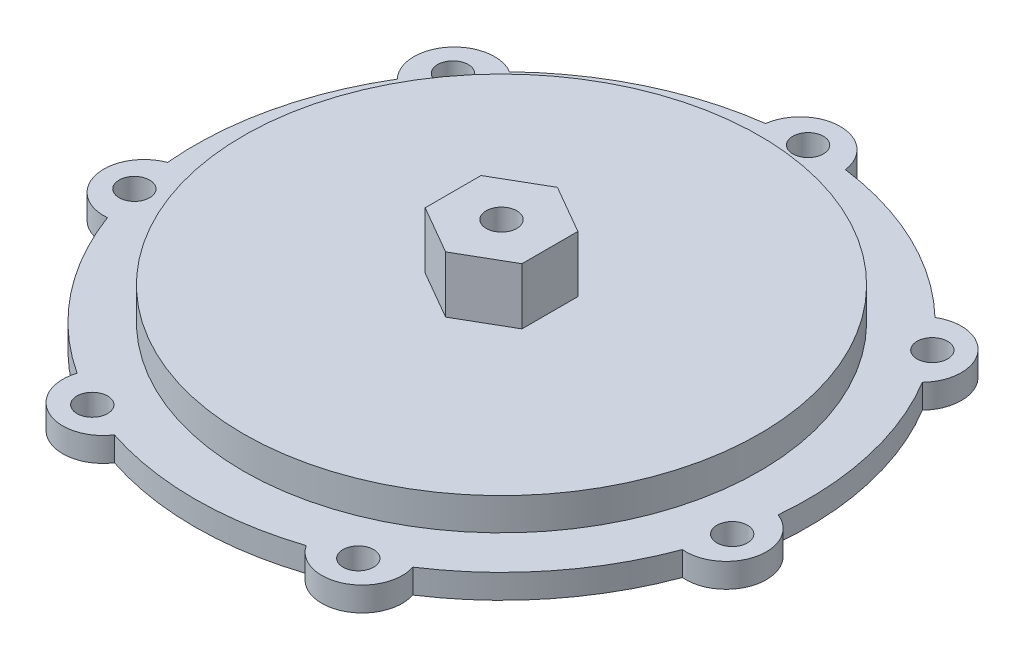
from build123d import *

# Parameters (mm, degrees)
SKETCH1_R           = 38
BOSS_EXTRUDE6_DEPTH = 7
SKETCH3_R           = 38
SKETCH3_R_2         = 35
BOSS_EXTRUDE7_DEPTH = 24
CIRPATTERN1_COUNT   = 24
BOSS_EXTRUDE8_DEPTH = 31
SKETCH6_3_R         = 1.9
CUT_EXTRUDE1_DEPTH  = 31
CIRPATTERN2_COUNT   = 7
BOSS_EXTRUDE9_DEPTH = 7
SKETCH8_R           = 1.9
CUT_EXTRUDE2_DEPTH  = 14
SKETCH9_R           = 42
SKETCH9_R_2         = 32
PART1_DEPTH         = 28


with BuildPart() as part:
    # Sketch1 → Boss-Extrude6 (new body)
    with BuildSketch(Plane(origin=(0, 0, 0), x_dir=(1, 0, 0), z_dir=(0, 1, 0))):
        with Locations(Location((0, 0, 0), (0, 0, 270))):
            Circle(SKETCH1_R)
    extrude(amount=BOSS_EXTRUDE6_DEPTH)

    # Sketch3 → Boss-Extrude7 (add)
    with BuildSketch(Plane(origin=(0, 7, 0), x_dir=(1, 0, 0), z_dir=(0, 1, 0))):
        with Locations(Location((0, 0, 0), (0, 0, 270))):
            Circle(SKETCH3_R)
        with Locations(Location((0, 0, 0), (0, 0, 270))):
            Circle(SKETCH3_R_2, mode=Mode.SUBTRACT)
    extrude(amount=BOSS_EXTRUDE7_DEPTH)

    # Sketch4 → Loft1 section 0
    with BuildSketch(Plane(origin=(0, 7, 0), x_dir=(1, 0, 0), z_dir=(0, 1, 0))):
        with BuildLine():
            Line((1, 33), (-1, 33))
            Line((-1, 33), (-3.355280929, 36))
            Line((-3.355280929, 36), (3.355280929, 36))
            Line((3.355280929, 36), (1, 33))
        make_face()
    # Sketch5 → Loft1 section 1
    with BuildSketch(Plane(origin=(0, 19, 0), x_dir=(0.9889879611668934, 0, 0.147995988685341), z_dir=(0, 1, 0))):
        with BuildLine():
            Line((1, 33), (-1, 33))
            Line((-1, 33), (-3.355280929, 36))
            Line((-3.355280929, 36), (3.355280929, 36))
            Line((3.355280929, 36), (1, 33))
        make_face()
    loft1 = loft()

    # CirPattern1: Loft1 ×24 about axis
    cirpattern1_axis = Axis((0, 7, 0), (0, -1, 0))
    for i in range(1, CIRPATTERN1_COUNT):
        add(loft1.rotate(cirpattern1_axis, i * 360 / CIRPATTERN1_COUNT))

    # Mirror1: read off the stored shape, not the designer's step
    # Mirror1: loft between two sections, ruled curve by curve
    mirror1_from = [
        Edge.make_bspline([(-1, 31, -33), (-0.666666667, 31, -33), (-0.333333333, 31, -33), (0.333333333, 31, -33), (0.666666667, 31, -33), (1, 31, -33)], [0, 0, 0, 0, 0.5, 0.5, 1, 1, 1, 1], 3),
        Edge.make_bspline([(1, 31, -33), (1.392546821, 31, -33.5), (1.785093643, 31, -34), (2.570187286, 31, -35), (2.962734107, 31, -35.5), (3.355280929, 31, -36)], [0, 0, 0, 0, 0.5, 0.5, 1, 1, 1, 1], 3),
        Edge.make_bspline([(-3.355280929, 31, -36), (-2.962734107, 31, -35.5), (-2.570187286, 31, -35), (-1.785093643, 31, -34), (-1.392546821, 31, -33.5), (-1, 31, -33)], [0, 0, 0, 0, 0.5, 0.5, 1, 1, 1, 1], 3),
        Edge.make_line((-3.355280929, 31, -36), (3.355280929, 31, -36)),
    ]
    mirror1_to = [
        Edge.make_bspline([(3.894879665, 19, -32.784598707), (4.224542319, 19, -32.735266711), (4.554204973, 19, -32.685934715), (5.21353028, 19, -32.587270722), (5.543192934, 19, -32.537938726), (5.872855588, 19, -32.48860673)], [0, 0, 0, 0, 0.5, 0.5, 1, 1, 1, 1], 3),
        Edge.make_bspline([(5.872855588, 19, -32.48860673), (6.335077663, 19, -32.925005355), (6.797299738, 19, -33.361403981), (7.721743888, 19, -34.234201232), (8.183965962, 19, -34.670599858), (8.646188037, 19, -35.106998484)], [0, 0, 0, 0, 0.5, 0.5, 1, 1, 1, 1], 3),
        Edge.make_bspline([(2.009523148, 19, -36.10013472), (2.323749234, 19, -35.547545385), (2.63797532, 19, -34.994956049), (3.266427493, 19, -33.889777378), (3.580653579, 19, -33.337188043), (3.894879665, 19, -32.784598707)], [0, 0, 0, 0, 0.5, 0.5, 1, 1, 1, 1], 3),
        Edge.make_line((2.009523148, 19, -36.10013472), (8.646188037, 19, -35.106998484)),
    ]
    mirror1 = Solid(Shell([*[Face.make_surface_from_curves(mirror1_from[k], mirror1_to[k]) for k in range(4)], Face(Wire(mirror1_from)), Face(Wire(mirror1_to))]))
    add(mirror1)

    # Mirror1 2: loft between two sections, ruled curve by curve
    mirror1_2_from = [
        Edge.make_bspline([(7.575102662, 31, -32.134371313), (7.897077938, 31, -32.048098298), (8.219053213, 31, -31.961825283), (8.863003764, 31, -31.789279253), (9.184979039, 31, -31.703006237), (9.506954315, 31, -31.616733222)], [0, 0, 0, 0, 0.5, 0.5, 1, 1, 1, 1], 3),
        Edge.make_bspline([(9.506954315, 31, -31.616733222), (10.01553495, 31, -31.998097542), (10.524115585, 31, -32.379461862), (11.541276856, 31, -33.142190501), (12.049857492, 31, -33.523554821), (12.558438127, 31, -33.90491914)], [0, 0, 0, 0, 0.5, 0.5, 1, 1, 1, 1], 3),
        Edge.make_bspline([(6.07653312, 31, -35.641740352), (6.326294711, 31, -35.057178846), (6.576056301, 31, -34.472617339), (7.075579481, 31, -33.303494326), (7.325341072, 31, -32.718932819), (7.575102662, 31, -32.134371313)], [0, 0, 0, 0, 0.5, 0.5, 1, 1, 1, 1], 3),
        Edge.make_line((6.07653312, 31, -35.641740352), (12.558438127, 31, -33.90491914)),
    ]
    mirror1_2_to = [
        Edge.make_bspline([(12.247443391, 19, -30.65942156), (12.553105002, 19, -30.526447538), (12.858766613, 19, -30.393473515), (13.470089835, 19, -30.12752547), (13.775751446, 19, -29.994551448), (14.081413057, 19, -29.861577425)], [0, 0, 0, 0, 0.5, 0.5, 1, 1, 1, 1], 3),
        Edge.make_bspline([(14.081413057, 19, -29.861577425), (14.640833572, 19, -30.163474252), (15.200254087, 19, -30.465371079), (16.319095118, 19, -31.069164733), (16.878515633, 19, -31.37106156), (17.437936148, 19, -31.672958387)], [0, 0, 0, 0, 0.5, 0.5, 1, 1, 1, 1], 3),
        Edge.make_bspline([(11.284452703, 19, -34.349949597), (11.444951151, 19, -33.734861591), (11.605449599, 19, -33.119773584), (11.926446495, 19, -31.889597572), (12.086944943, 19, -31.274509566), (12.247443391, 19, -30.65942156)], [0, 0, 0, 0, 0.5, 0.5, 1, 1, 1, 1], 3),
        Edge.make_line((11.284452703, 19, -34.349949597), (17.437936148, 19, -31.672958387)),
    ]
    mirror1_2 = Solid(Shell([*[Face.make_surface_from_curves(mirror1_2_from[k], mirror1_2_to[k]) for k in range(4)], Face(Wire(mirror1_2_from)), Face(Wire(mirror1_2_to))]))
    add(mirror1_2)

    # Mirror1 3: loft between two sections, ruled curve by curve
    mirror1_3_from = [
        Edge.make_bspline([(15.633974596, 31, -29.078838325), (15.922649731, 31, -28.912171658), (16.211324865, 31, -28.745504992), (16.788675135, 31, -28.412171658), (17.077350269, 31, -28.245504992), (17.366025404, 31, -28.078838325)], [0, 0, 0, 0, 0.5, 0.5, 1, 1, 1, 1], 3),
        Edge.make_bspline([(17.366025404, 31, -28.078838325), (17.955980923, 31, -28.315577616), (18.545936443, 31, -28.552316907), (19.725847482, 31, -29.02579549), (20.315803002, 31, -29.262534781), (20.905758521, 31, -29.499274072)], [0, 0, 0, 0, 0.5, 0.5, 1, 1, 1, 1], 3),
        Edge.make_bspline([(15.094241479, 31, -32.854555001), (15.184196998, 31, -32.225268888), (15.274152518, 31, -31.595982775), (15.454063557, 31, -30.33741055), (15.544019077, 31, -29.708124437), (15.633974596, 31, -29.078838325)], [0, 0, 0, 0, 0.5, 0.5, 1, 1, 1, 1], 3),
        Edge.make_line((15.094241479, 31, -32.854555001), (20.905758521, 31, -29.499274072)),
    ]
    mirror1_3_to = [
        Edge.make_bspline([(19.765364089, 19, -26.444855501), (20.026194323, 19, -26.237301412), (20.287024558, 19, -26.029747323), (20.808685027, 19, -25.614639145), (21.069515262, 19, -25.407085057), (21.330345497, 19, -25.199530968)], [0, 0, 0, 0, 0.5, 0.5, 1, 1, 1, 1], 3),
        Edge.make_bspline([(21.330345497, 19, -25.199530968), (21.948840869, 19, -25.346352226), (22.567336241, 19, -25.493173485), (23.804326984, 19, -25.786816002), (24.422822356, 19, -25.93363726), (25.041317728, 19, -26.080458519)], [0, 0, 0, 0, 0.5, 0.5, 1, 1, 1, 1], 3),
        Edge.make_bspline([(19.790365456, 19, -30.258872174), (19.786198561, 19, -29.623202728), (19.782031667, 19, -28.987533283), (19.773697878, 19, -27.716194392), (19.769530983, 19, -27.080524946), (19.765364089, 19, -26.444855501)], [0, 0, 0, 0, 0.5, 0.5, 1, 1, 1, 1], 3),
        Edge.make_line((19.790365456, 19, -30.258872174), (25.041317728, 19, -26.080458519)),
    ]
    mirror1_3 = Solid(Shell([*[Face.make_surface_from_curves(mirror1_3_from[k], mirror1_3_to[k]) for k in range(4)], Face(Wire(mirror1_3_from)), Face(Wire(mirror1_3_to))]))
    add(mirror1_3)

    # Mirror1 4: loft between two sections, ruled curve by curve
    mirror1_4_from = [
        Edge.make_bspline([(22.627416998, 31, -24.04163056), (22.863119258, 31, -23.8059283), (23.098821519, 31, -23.57022604), (23.57022604, 31, -23.098821519), (23.8059283, 31, -22.863119258), (24.04163056, 31, -22.627416998)], [0, 0, 0, 0, 0.5, 0.5, 1, 1, 1, 1], 3),
        Edge.make_bspline([(24.04163056, 31, -22.627416998), (24.67275647, 31, -22.703397869), (25.30388238, 31, -22.77937874), (26.5661342, 31, -22.931340483), (27.19726011, 31, -23.007321354), (27.82838602, 31, -23.083302225)], [0, 0, 0, 0, 0.5, 0.5, 1, 1, 1, 1], 3),
        Edge.make_bspline([(23.083302225, 31, -27.82838602), (23.007321354, 31, -27.19726011), (22.931340483, 31, -26.5661342), (22.77937874, 31, -25.30388238), (22.703397869, 31, -24.67275647), (22.627416998, 31, -24.04163056)], [0, 0, 0, 0, 0.5, 0.5, 1, 1, 1, 1], 3),
        Edge.make_line((23.083302225, 31, -27.82838602), (27.82838602, 31, -23.083302225)),
    ]
    mirror1_4_to = [
        Edge.make_bspline([(25.936307888, 19, -20.428116241), (26.134531597, 19, -20.160126554), (26.332755305, 19, -19.892136867), (26.729202723, 19, -19.356157493), (26.927426432, 19, -19.088167806), (27.125650141, 19, -18.820178119)], [0, 0, 0, 0, 0.5, 0.5, 1, 1, 1, 1], 3),
        Edge.make_bspline([(27.125650141, 19, -18.820178119), (27.761070932, 19, -18.801918183), (28.396491723, 19, -18.783658247), (29.667333305, 19, -18.747138374), (30.302754096, 19, -18.728878438), (30.938174888, 19, -18.710618502)], [0, 0, 0, 0, 0.5, 0.5, 1, 1, 1, 1], 3),
        Edge.make_bspline([(26.947597507, 19, -24.105702618), (26.779049237, 19, -23.492771555), (26.610500967, 19, -22.879840492), (26.273404428, 19, -21.653978367), (26.104856158, 19, -21.041047304), (25.936307888, 19, -20.428116241)], [0, 0, 0, 0, 0.5, 0.5, 1, 1, 1, 1], 3),
        Edge.make_line((26.947597507, 19, -24.105702618), (30.938174888, 19, -18.710618502)),
    ]
    mirror1_4 = Solid(Shell([*[Face.make_surface_from_curves(mirror1_4_from[k], mirror1_4_to[k]) for k in range(4)], Face(Wire(mirror1_4_from)), Face(Wire(mirror1_4_to))]))
    add(mirror1_4)

    # Mirror1 5: loft between two sections, ruled curve by curve
    mirror1_5_from = [
        Edge.make_bspline([(28.078838325, 31, -17.366025404), (28.245504992, 31, -17.077350269), (28.412171658, 31, -16.788675135), (28.745504992, 31, -16.211324865), (28.912171658, 31, -15.922649731), (29.078838325, 31, -15.633974596)], [0, 0, 0, 0, 0.5, 0.5, 1, 1, 1, 1], 3),
        Edge.make_bspline([(29.078838325, 31, -15.633974596), (29.708124437, 31, -15.544019077), (30.33741055, 31, -15.454063557), (31.595982775, 31, -15.274152518), (32.225268888, 31, -15.184196998), (32.854555001, 31, -15.094241479)], [0, 0, 0, 0, 0.5, 0.5, 1, 1, 1, 1], 3),
        Edge.make_bspline([(29.499274072, 31, -20.905758521), (29.262534781, 31, -20.315803002), (29.02579549, 31, -19.725847482), (28.552316907, 31, -18.545936443), (28.315577616, 31, -17.955980923), (28.078838325, 31, -17.366025404)], [0, 0, 0, 0, 0.5, 0.5, 1, 1, 1, 1], 3),
        Edge.make_line((29.499274072, 31, -20.905758521), (32.854555001, 31, -15.094241479)),
    ]
    mirror1_5_to = [
        Edge.make_bspline([(30.339735166, 19, -13.019234619), (30.461843731, 19, -12.709072388), (30.583952296, 19, -12.398910157), (30.828169426, 19, -11.778585695), (30.950277991, 19, -11.468423464), (31.072386555, 19, -11.158261233)], [0, 0, 0, 0, 0.5, 0.5, 1, 1, 1, 1], 3),
        Edge.make_bspline([(31.072386555, 19, -11.158261233), (31.681429889, 19, -10.976164487), (32.290473222, 19, -10.794067741), (33.508559889, 19, -10.429874248), (34.117603223, 19, -10.247777502), (34.726646556, 19, -10.065680756)], [0, 0, 0, 0, 0.5, 0.5, 1, 1, 1, 1], 3),
        Edge.make_bspline([(32.268395322, 19, -16.309769265), (31.946951963, 19, -15.761346824), (31.625508603, 19, -15.212924383), (30.982621885, 19, -14.116079501), (30.661178525, 19, -13.56765706), (30.339735166, 19, -13.019234619)], [0, 0, 0, 0, 0.5, 0.5, 1, 1, 1, 1], 3),
        Edge.make_line((32.268395322, 19, -16.309769265), (34.726646556, 19, -10.065680756)),
    ]
    mirror1_5 = Solid(Shell([*[Face.make_surface_from_curves(mirror1_5_from[k], mirror1_5_to[k]) for k in range(4)], Face(Wire(mirror1_5_from)), Face(Wire(mirror1_5_to))]))
    add(mirror1_5)

    # Mirror1 6: loft between two sections, ruled curve by curve
    mirror1_6_from = [
        Edge.make_bspline([(31.616733222, 31, -9.506954315), (31.703006237, 31, -9.184979039), (31.789279253, 31, -8.863003764), (31.961825283, 31, -8.219053213), (32.048098298, 31, -7.897077938), (32.134371313, 31, -7.575102662)], [0, 0, 0, 0, 0.5, 0.5, 1, 1, 1, 1], 3),
        Edge.make_bspline([(32.134371313, 31, -7.575102662), (32.718932819, 31, -7.325341072), (33.303494326, 31, -7.075579481), (34.472617339, 31, -6.576056301), (35.057178846, 31, -6.326294711), (35.641740352, 31, -6.07653312)], [0, 0, 0, 0, 0.5, 0.5, 1, 1, 1, 1], 3),
        Edge.make_bspline([(33.90491914, 31, -12.558438127), (33.523554821, 31, -12.049857492), (33.142190501, 31, -11.541276856), (32.379461862, 31, -10.524115585), (31.998097542, 31, -10.01553495), (31.616733222, 31, -9.506954315)], [0, 0, 0, 0, 0.5, 0.5, 1, 1, 1, 1], 3),
        Edge.make_line((33.90491914, 31, -12.558438127), (35.641740352, 31, -6.07653312)),
    ]
    mirror1_6_to = [
        Edge.make_bspline([(32.675559632, 19, -4.723113672), (32.713231556, 19, -4.391915941), (32.75090348, 19, -4.06071821), (32.826247328, 19, -3.398322747), (32.863919252, 19, -3.067125016), (32.901591176, 19, -2.735927284)], [0, 0, 0, 0, 0.5, 0.5, 1, 1, 1, 1], 3),
        Edge.make_bspline([(32.901591176, 19, -2.735927284), (33.442751755, 19, -2.40240332), (33.983912334, 19, -2.068879356), (35.066233492, 19, -1.401831428), (35.607394071, 19, -1.068307464), (36.14855465, 19, -0.7347835)], [0, 0, 0, 0, 0.5, 0.5, 1, 1, 1, 1], 3),
        Edge.make_bspline([(35.390155321, 19, -7.402352089), (34.937722706, 19, -6.955812353), (34.485290091, 19, -6.509272617), (33.580424861, 19, -5.616193145), (33.127992247, 19, -5.169653408), (32.675559632, 19, -4.723113672)], [0, 0, 0, 0, 0.5, 0.5, 1, 1, 1, 1], 3),
        Edge.make_line((35.390155321, 19, -7.402352089), (36.14855465, 19, -0.7347835)),
    ]
    mirror1_6 = Solid(Shell([*[Face.make_surface_from_curves(mirror1_6_from[k], mirror1_6_to[k]) for k in range(4)], Face(Wire(mirror1_6_from)), Face(Wire(mirror1_6_to))]))
    add(mirror1_6)

    # Mirror1 7: loft between two sections, ruled curve by curve
    mirror1_7_from = [
        Edge.make_bspline([(33, 31, -1), (33, 31, -0.666666667), (33, 31, -0.333333333), (33, 31, 0.333333333), (33, 31, 0.666666667), (33, 31, 1)], [0, 0, 0, 0, 0.5, 0.5, 1, 1, 1, 1], 3),
        Edge.make_bspline([(33, 31, 1), (33.5, 31, 1.392546821), (34, 31, 1.785093643), (35, 31, 2.570187286), (35.5, 31, 2.962734107), (36, 31, 3.355280929)], [0, 0, 0, 0, 0.5, 0.5, 1, 1, 1, 1], 3),
        Edge.make_bspline([(36, 31, -3.355280929), (35.5, 31, -2.962734107), (35, 31, -2.570187286), (34, 31, -1.785093643), (33.5, 31, -1.392546821), (33, 31, -1)], [0, 0, 0, 0, 0.5, 0.5, 1, 1, 1, 1], 3),
        Edge.make_line((36, 31, -3.355280929), (36, 31, 3.355280929)),
    ]
    mirror1_7_to = [
        Edge.make_bspline([(32.784598707, 19, 3.894879665), (32.735266711, 19, 4.224542319), (32.685934715, 19, 4.554204973), (32.587270722, 19, 5.21353028), (32.537938726, 19, 5.543192934), (32.48860673, 19, 5.872855588)], [0, 0, 0, 0, 0.5, 0.5, 1, 1, 1, 1], 3),
        Edge.make_bspline([(32.48860673, 19, 5.872855588), (32.925005355, 19, 6.335077663), (33.361403981, 19, 6.797299738), (34.234201232, 19, 7.721743888), (34.670599858, 19, 8.183965962), (35.106998484, 19, 8.646188037)], [0, 0, 0, 0, 0.5, 0.5, 1, 1, 1, 1], 3),
        Edge.make_bspline([(36.10013472, 19, 2.009523148), (35.547545385, 19, 2.323749234), (34.994956049, 19, 2.63797532), (33.889777378, 19, 3.266427493), (33.337188043, 19, 3.580653579), (32.784598707, 19, 3.894879665)], [0, 0, 0, 0, 0.5, 0.5, 1, 1, 1, 1], 3),
        Edge.make_line((36.10013472, 19, 2.009523148), (35.106998484, 19, 8.646188037)),
    ]
    mirror1_7 = Solid(Shell([*[Face.make_surface_from_curves(mirror1_7_from[k], mirror1_7_to[k]) for k in range(4)], Face(Wire(mirror1_7_from)), Face(Wire(mirror1_7_to))]))
    add(mirror1_7)

    # Mirror1 8: loft between two sections, ruled curve by curve
    mirror1_8_from = [
        Edge.make_bspline([(32.134371313, 31, 7.575102662), (32.048098298, 31, 7.897077938), (31.961825283, 31, 8.219053213), (31.789279253, 31, 8.863003764), (31.703006237, 31, 9.184979039), (31.616733222, 31, 9.506954315)], [0, 0, 0, 0, 0.5, 0.5, 1, 1, 1, 1], 3),
        Edge.make_bspline([(31.616733222, 31, 9.506954315), (31.998097542, 31, 10.01553495), (32.379461862, 31, 10.524115585), (33.142190501, 31, 11.541276856), (33.523554821, 31, 12.049857492), (33.90491914, 31, 12.558438127)], [0, 0, 0, 0, 0.5, 0.5, 1, 1, 1, 1], 3),
        Edge.make_bspline([(35.641740352, 31, 6.07653312), (35.057178846, 31, 6.326294711), (34.472617339, 31, 6.576056301), (33.303494326, 31, 7.075579481), (32.718932819, 31, 7.325341072), (32.134371313, 31, 7.575102662)], [0, 0, 0, 0, 0.5, 0.5, 1, 1, 1, 1], 3),
        Edge.make_line((35.641740352, 31, 6.07653312), (33.90491914, 31, 12.558438127)),
    ]
    mirror1_8_to = [
        Edge.make_bspline([(30.65942156, 19, 12.247443391), (30.526447538, 19, 12.553105002), (30.393473515, 19, 12.858766613), (30.12752547, 19, 13.470089835), (29.994551448, 19, 13.775751446), (29.861577425, 19, 14.081413057)], [0, 0, 0, 0, 0.5, 0.5, 1, 1, 1, 1], 3),
        Edge.make_bspline([(29.861577425, 19, 14.081413057), (30.163474252, 19, 14.640833572), (30.465371079, 19, 15.200254087), (31.069164733, 19, 16.319095118), (31.37106156, 19, 16.878515633), (31.672958387, 19, 17.437936148)], [0, 0, 0, 0, 0.5, 0.5, 1, 1, 1, 1], 3),
        Edge.make_bspline([(34.349949597, 19, 11.284452703), (33.734861591, 19, 11.444951151), (33.119773584, 19, 11.605449599), (31.889597572, 19, 11.926446495), (31.274509566, 19, 12.086944943), (30.65942156, 19, 12.247443391)], [0, 0, 0, 0, 0.5, 0.5, 1, 1, 1, 1], 3),
        Edge.make_line((34.349949597, 19, 11.284452703), (31.672958387, 19, 17.437936148)),
    ]
    mirror1_8 = Solid(Shell([*[Face.make_surface_from_curves(mirror1_8_from[k], mirror1_8_to[k]) for k in range(4)], Face(Wire(mirror1_8_from)), Face(Wire(mirror1_8_to))]))
    add(mirror1_8)

    # Mirror1 9: loft between two sections, ruled curve by curve
    mirror1_9_from = [
        Edge.make_bspline([(29.078838325, 31, 15.633974596), (28.912171658, 31, 15.922649731), (28.745504992, 31, 16.211324865), (28.412171658, 31, 16.788675135), (28.245504992, 31, 17.077350269), (28.078838325, 31, 17.366025404)], [0, 0, 0, 0, 0.5, 0.5, 1, 1, 1, 1], 3),
        Edge.make_bspline([(28.078838325, 31, 17.366025404), (28.315577616, 31, 17.955980923), (28.552316907, 31, 18.545936443), (29.02579549, 31, 19.725847482), (29.262534781, 31, 20.315803002), (29.499274072, 31, 20.905758521)], [0, 0, 0, 0, 0.5, 0.5, 1, 1, 1, 1], 3),
        Edge.make_bspline([(32.854555001, 31, 15.094241479), (32.225268888, 31, 15.184196998), (31.595982775, 31, 15.274152518), (30.33741055, 31, 15.454063557), (29.708124437, 31, 15.544019077), (29.078838325, 31, 15.633974596)], [0, 0, 0, 0, 0.5, 0.5, 1, 1, 1, 1], 3),
        Edge.make_line((32.854555001, 31, 15.094241479), (29.499274072, 31, 20.905758521)),
    ]
    mirror1_9_to = [
        Edge.make_bspline([(26.444855501, 19, 19.765364089), (26.237301412, 19, 20.026194323), (26.029747323, 19, 20.287024558), (25.614639145, 19, 20.808685027), (25.407085057, 19, 21.069515262), (25.199530968, 19, 21.330345497)], [0, 0, 0, 0, 0.5, 0.5, 1, 1, 1, 1], 3),
        Edge.make_bspline([(25.199530968, 19, 21.330345497), (25.346352226, 19, 21.948840869), (25.493173485, 19, 22.567336241), (25.786816002, 19, 23.804326984), (25.93363726, 19, 24.422822356), (26.080458519, 19, 25.041317728)], [0, 0, 0, 0, 0.5, 0.5, 1, 1, 1, 1], 3),
        Edge.make_bspline([(30.258872174, 19, 19.790365456), (29.623202728, 19, 19.786198561), (28.987533283, 19, 19.782031667), (27.716194392, 19, 19.773697878), (27.080524946, 19, 19.769530983), (26.444855501, 19, 19.765364089)], [0, 0, 0, 0, 0.5, 0.5, 1, 1, 1, 1], 3),
        Edge.make_line((30.258872174, 19, 19.790365456), (26.080458519, 19, 25.041317728)),
    ]
    mirror1_9 = Solid(Shell([*[Face.make_surface_from_curves(mirror1_9_from[k], mirror1_9_to[k]) for k in range(4)], Face(Wire(mirror1_9_from)), Face(Wire(mirror1_9_to))]))
    add(mirror1_9)

    # Mirror1 10: loft between two sections, ruled curve by curve
    mirror1_10_from = [
        Edge.make_bspline([(24.04163056, 31, 22.627416998), (23.8059283, 31, 22.863119258), (23.57022604, 31, 23.098821519), (23.098821519, 31, 23.57022604), (22.863119258, 31, 23.8059283), (22.627416998, 31, 24.04163056)], [0, 0, 0, 0, 0.5, 0.5, 1, 1, 1, 1], 3),
        Edge.make_bspline([(22.627416998, 31, 24.04163056), (22.703397869, 31, 24.67275647), (22.77937874, 31, 25.30388238), (22.931340483, 31, 26.5661342), (23.007321354, 31, 27.19726011), (23.083302225, 31, 27.82838602)], [0, 0, 0, 0, 0.5, 0.5, 1, 1, 1, 1], 3),
        Edge.make_bspline([(27.82838602, 31, 23.083302225), (27.19726011, 31, 23.007321354), (26.5661342, 31, 22.931340483), (25.30388238, 31, 22.77937874), (24.67275647, 31, 22.703397869), (24.04163056, 31, 22.627416998)], [0, 0, 0, 0, 0.5, 0.5, 1, 1, 1, 1], 3),
        Edge.make_line((27.82838602, 31, 23.083302225), (23.083302225, 31, 27.82838602)),
    ]
    mirror1_10_to = [
        Edge.make_bspline([(20.428116241, 19, 25.936307888), (20.160126554, 19, 26.134531597), (19.892136867, 19, 26.332755305), (19.356157493, 19, 26.729202723), (19.088167806, 19, 26.927426432), (18.820178119, 19, 27.125650141)], [0, 0, 0, 0, 0.5, 0.5, 1, 1, 1, 1], 3),
        Edge.make_bspline([(18.820178119, 19, 27.125650141), (18.801918183, 19, 27.761070932), (18.783658247, 19, 28.396491723), (18.747138374, 19, 29.667333305), (18.728878438, 19, 30.302754096), (18.710618502, 19, 30.938174888)], [0, 0, 0, 0, 0.5, 0.5, 1, 1, 1, 1], 3),
        Edge.make_bspline([(24.105702618, 19, 26.947597507), (23.492771555, 19, 26.779049237), (22.879840492, 19, 26.610500967), (21.653978367, 19, 26.273404428), (21.041047304, 19, 26.104856158), (20.428116241, 19, 25.936307888)], [0, 0, 0, 0, 0.5, 0.5, 1, 1, 1, 1], 3),
        Edge.make_line((24.105702618, 19, 26.947597507), (18.710618502, 19, 30.938174888)),
    ]
    mirror1_10 = Solid(Shell([*[Face.make_surface_from_curves(mirror1_10_from[k], mirror1_10_to[k]) for k in range(4)], Face(Wire(mirror1_10_from)), Face(Wire(mirror1_10_to))]))
    add(mirror1_10)

    # Mirror1 11: loft between two sections, ruled curve by curve
    mirror1_11_from = [
        Edge.make_bspline([(17.366025404, 31, 28.078838325), (17.077350269, 31, 28.245504992), (16.788675135, 31, 28.412171658), (16.211324865, 31, 28.745504992), (15.922649731, 31, 28.912171658), (15.633974596, 31, 29.078838325)], [0, 0, 0, 0, 0.5, 0.5, 1, 1, 1, 1], 3),
        Edge.make_bspline([(15.633974596, 31, 29.078838325), (15.544019077, 31, 29.708124437), (15.454063557, 31, 30.33741055), (15.274152518, 31, 31.595982775), (15.184196998, 31, 32.225268888), (15.094241479, 31, 32.854555001)], [0, 0, 0, 0, 0.5, 0.5, 1, 1, 1, 1], 3),
        Edge.make_bspline([(20.905758521, 31, 29.499274072), (20.315803002, 31, 29.262534781), (19.725847482, 31, 29.02579549), (18.545936443, 31, 28.552316907), (17.955980923, 31, 28.315577616), (17.366025404, 31, 28.078838325)], [0, 0, 0, 0, 0.5, 0.5, 1, 1, 1, 1], 3),
        Edge.make_line((20.905758521, 31, 29.499274072), (15.094241479, 31, 32.854555001)),
    ]
    mirror1_11_to = [
        Edge.make_bspline([(13.019234619, 19, 30.339735166), (12.709072388, 19, 30.461843731), (12.398910157, 19, 30.583952296), (11.778585695, 19, 30.828169426), (11.468423464, 19, 30.950277991), (11.158261233, 19, 31.072386555)], [0, 0, 0, 0, 0.5, 0.5, 1, 1, 1, 1], 3),
        Edge.make_bspline([(11.158261233, 19, 31.072386555), (10.976164487, 19, 31.681429889), (10.794067741, 19, 32.290473222), (10.429874248, 19, 33.508559889), (10.247777502, 19, 34.117603223), (10.065680756, 19, 34.726646556)], [0, 0, 0, 0, 0.5, 0.5, 1, 1, 1, 1], 3),
        Edge.make_bspline([(16.309769265, 19, 32.268395322), (15.761346824, 19, 31.946951963), (15.212924383, 19, 31.625508603), (14.116079501, 19, 30.982621885), (13.56765706, 19, 30.661178525), (13.019234619, 19, 30.339735166)], [0, 0, 0, 0, 0.5, 0.5, 1, 1, 1, 1], 3),
        Edge.make_line((16.309769265, 19, 32.268395322), (10.065680756, 19, 34.726646556)),
    ]
    mirror1_11 = Solid(Shell([*[Face.make_surface_from_curves(mirror1_11_from[k], mirror1_11_to[k]) for k in range(4)], Face(Wire(mirror1_11_from)), Face(Wire(mirror1_11_to))]))
    add(mirror1_11)

    # Mirror1 12: loft between two sections, ruled curve by curve
    mirror1_12_from = [
        Edge.make_bspline([(9.506954315, 31, 31.616733222), (9.184979039, 31, 31.703006237), (8.863003764, 31, 31.789279253), (8.219053213, 31, 31.961825283), (7.897077938, 31, 32.048098298), (7.575102662, 31, 32.134371313)], [0, 0, 0, 0, 0.5, 0.5, 1, 1, 1, 1], 3),
        Edge.make_bspline([(7.575102662, 31, 32.134371313), (7.325341072, 31, 32.718932819), (7.075579481, 31, 33.303494326), (6.576056301, 31, 34.472617339), (6.326294711, 31, 35.057178846), (6.07653312, 31, 35.641740352)], [0, 0, 0, 0, 0.5, 0.5, 1, 1, 1, 1], 3),
        Edge.make_bspline([(12.558438127, 31, 33.90491914), (12.049857492, 31, 33.523554821), (11.541276856, 31, 33.142190501), (10.524115585, 31, 32.379461862), (10.01553495, 31, 31.998097542), (9.506954315, 31, 31.616733222)], [0, 0, 0, 0, 0.5, 0.5, 1, 1, 1, 1], 3),
        Edge.make_line((12.558438127, 31, 33.90491914), (6.07653312, 31, 35.641740352)),
    ]
    mirror1_12_to = [
        Edge.make_bspline([(4.723113672, 19, 32.675559632), (4.391915941, 19, 32.713231556), (4.06071821, 19, 32.75090348), (3.398322747, 19, 32.826247328), (3.067125016, 19, 32.863919252), (2.735927284, 19, 32.901591176)], [0, 0, 0, 0, 0.5, 0.5, 1, 1, 1, 1], 3),
        Edge.make_bspline([(2.735927284, 19, 32.901591176), (2.40240332, 19, 33.442751755), (2.068879356, 19, 33.983912334), (1.401831428, 19, 35.066233492), (1.068307464, 19, 35.607394071), (0.7347835, 19, 36.14855465)], [0, 0, 0, 0, 0.5, 0.5, 1, 1, 1, 1], 3),
        Edge.make_bspline([(7.402352089, 19, 35.390155321), (6.955812353, 19, 34.937722706), (6.509272617, 19, 34.485290091), (5.616193145, 19, 33.580424861), (5.169653408, 19, 33.127992247), (4.723113672, 19, 32.675559632)], [0, 0, 0, 0, 0.5, 0.5, 1, 1, 1, 1], 3),
        Edge.make_line((7.402352089, 19, 35.390155321), (0.7347835, 19, 36.14855465)),
    ]
    mirror1_12 = Solid(Shell([*[Face.make_surface_from_curves(mirror1_12_from[k], mirror1_12_to[k]) for k in range(4)], Face(Wire(mirror1_12_from)), Face(Wire(mirror1_12_to))]))
    add(mirror1_12)

    # Mirror1 13: loft between two sections, ruled curve by curve
    mirror1_13_from = [
        Edge.make_bspline([(1, 31, 33), (0.666666667, 31, 33), (0.333333333, 31, 33), (-0.333333333, 31, 33), (-0.666666667, 31, 33), (-1, 31, 33)], [0, 0, 0, 0, 0.5, 0.5, 1, 1, 1, 1], 3),
        Edge.make_bspline([(-1, 31, 33), (-1.392546821, 31, 33.5), (-1.785093643, 31, 34), (-2.570187286, 31, 35), (-2.962734107, 31, 35.5), (-3.355280929, 31, 36)], [0, 0, 0, 0, 0.5, 0.5, 1, 1, 1, 1], 3),
        Edge.make_bspline([(3.355280929, 31, 36), (2.962734107, 31, 35.5), (2.570187286, 31, 35), (1.785093643, 31, 34), (1.392546821, 31, 33.5), (1, 31, 33)], [0, 0, 0, 0, 0.5, 0.5, 1, 1, 1, 1], 3),
        Edge.make_line((3.355280929, 31, 36), (-3.355280929, 31, 36)),
    ]
    mirror1_13_to = [
        Edge.make_bspline([(-3.894879665, 19, 32.784598707), (-4.224542319, 19, 32.735266711), (-4.554204973, 19, 32.685934715), (-5.21353028, 19, 32.587270722), (-5.543192934, 19, 32.537938726), (-5.872855588, 19, 32.48860673)], [0, 0, 0, 0, 0.5, 0.5, 1, 1, 1, 1], 3),
        Edge.make_bspline([(-5.872855588, 19, 32.48860673), (-6.335077663, 19, 32.925005355), (-6.797299738, 19, 33.361403981), (-7.721743888, 19, 34.234201232), (-8.183965962, 19, 34.670599858), (-8.646188037, 19, 35.106998484)], [0, 0, 0, 0, 0.5, 0.5, 1, 1, 1, 1], 3),
        Edge.make_bspline([(-2.009523148, 19, 36.10013472), (-2.323749234, 19, 35.547545385), (-2.63797532, 19, 34.994956049), (-3.266427493, 19, 33.889777378), (-3.580653579, 19, 33.337188043), (-3.894879665, 19, 32.784598707)], [0, 0, 0, 0, 0.5, 0.5, 1, 1, 1, 1], 3),
        Edge.make_line((-2.009523148, 19, 36.10013472), (-8.646188037, 19, 35.106998484)),
    ]
    mirror1_13 = Solid(Shell([*[Face.make_surface_from_curves(mirror1_13_from[k], mirror1_13_to[k]) for k in range(4)], Face(Wire(mirror1_13_from)), Face(Wire(mirror1_13_to))]))
    add(mirror1_13)

    # Mirror1 14: loft between two sections, ruled curve by curve
    mirror1_14_from = [
        Edge.make_bspline([(-7.575102662, 31, 32.134371313), (-7.897077938, 31, 32.048098298), (-8.219053213, 31, 31.961825283), (-8.863003764, 31, 31.789279253), (-9.184979039, 31, 31.703006237), (-9.506954315, 31, 31.616733222)], [0, 0, 0, 0, 0.5, 0.5, 1, 1, 1, 1], 3),
        Edge.make_bspline([(-9.506954315, 31, 31.616733222), (-10.01553495, 31, 31.998097542), (-10.524115585, 31, 32.379461862), (-11.541276856, 31, 33.142190501), (-12.049857492, 31, 33.523554821), (-12.558438127, 31, 33.90491914)], [0, 0, 0, 0, 0.5, 0.5, 1, 1, 1, 1], 3),
        Edge.make_bspline([(-6.07653312, 31, 35.641740352), (-6.326294711, 31, 35.057178846), (-6.576056301, 31, 34.472617339), (-7.075579481, 31, 33.303494326), (-7.325341072, 31, 32.718932819), (-7.575102662, 31, 32.134371313)], [0, 0, 0, 0, 0.5, 0.5, 1, 1, 1, 1], 3),
        Edge.make_line((-6.07653312, 31, 35.641740352), (-12.558438127, 31, 33.90491914)),
    ]
    mirror1_14_to = [
        Edge.make_bspline([(-12.247443391, 19, 30.65942156), (-12.553105002, 19, 30.526447538), (-12.858766613, 19, 30.393473515), (-13.470089835, 19, 30.12752547), (-13.775751446, 19, 29.994551448), (-14.081413057, 19, 29.861577425)], [0, 0, 0, 0, 0.5, 0.5, 1, 1, 1, 1], 3),
        Edge.make_bspline([(-14.081413057, 19, 29.861577425), (-14.640833572, 19, 30.163474252), (-15.200254087, 19, 30.465371079), (-16.319095118, 19, 31.069164733), (-16.878515633, 19, 31.37106156), (-17.437936148, 19, 31.672958387)], [0, 0, 0, 0, 0.5, 0.5, 1, 1, 1, 1], 3),
        Edge.make_bspline([(-11.284452703, 19, 34.349949597), (-11.444951151, 19, 33.734861591), (-11.605449599, 19, 33.119773584), (-11.926446495, 19, 31.889597572), (-12.086944943, 19, 31.274509566), (-12.247443391, 19, 30.65942156)], [0, 0, 0, 0, 0.5, 0.5, 1, 1, 1, 1], 3),
        Edge.make_line((-11.284452703, 19, 34.349949597), (-17.437936148, 19, 31.672958387)),
    ]
    mirror1_14 = Solid(Shell([*[Face.make_surface_from_curves(mirror1_14_from[k], mirror1_14_to[k]) for k in range(4)], Face(Wire(mirror1_14_from)), Face(Wire(mirror1_14_to))]))
    add(mirror1_14)

    # Mirror1 15: loft between two sections, ruled curve by curve
    mirror1_15_from = [
        Edge.make_bspline([(-15.633974596, 31, 29.078838325), (-15.922649731, 31, 28.912171658), (-16.211324865, 31, 28.745504992), (-16.788675135, 31, 28.412171658), (-17.077350269, 31, 28.245504992), (-17.366025404, 31, 28.078838325)], [0, 0, 0, 0, 0.5, 0.5, 1, 1, 1, 1], 3),
        Edge.make_bspline([(-17.366025404, 31, 28.078838325), (-17.955980923, 31, 28.315577616), (-18.545936443, 31, 28.552316907), (-19.725847482, 31, 29.02579549), (-20.315803002, 31, 29.262534781), (-20.905758521, 31, 29.499274072)], [0, 0, 0, 0, 0.5, 0.5, 1, 1, 1, 1], 3),
        Edge.make_bspline([(-15.094241479, 31, 32.854555001), (-15.184196998, 31, 32.225268888), (-15.274152518, 31, 31.595982775), (-15.454063557, 31, 30.33741055), (-15.544019077, 31, 29.708124437), (-15.633974596, 31, 29.078838325)], [0, 0, 0, 0, 0.5, 0.5, 1, 1, 1, 1], 3),
        Edge.make_line((-15.094241479, 31, 32.854555001), (-20.905758521, 31, 29.499274072)),
    ]
    mirror1_15_to = [
        Edge.make_bspline([(-19.765364089, 19, 26.444855501), (-20.026194323, 19, 26.237301412), (-20.287024558, 19, 26.029747323), (-20.808685027, 19, 25.614639145), (-21.069515262, 19, 25.407085057), (-21.330345497, 19, 25.199530968)], [0, 0, 0, 0, 0.5, 0.5, 1, 1, 1, 1], 3),
        Edge.make_bspline([(-21.330345497, 19, 25.199530968), (-21.948840869, 19, 25.346352226), (-22.567336241, 19, 25.493173485), (-23.804326984, 19, 25.786816002), (-24.422822356, 19, 25.93363726), (-25.041317728, 19, 26.080458519)], [0, 0, 0, 0, 0.5, 0.5, 1, 1, 1, 1], 3),
        Edge.make_bspline([(-19.790365456, 19, 30.258872174), (-19.786198561, 19, 29.623202728), (-19.782031667, 19, 28.987533283), (-19.773697878, 19, 27.716194392), (-19.769530983, 19, 27.080524946), (-19.765364089, 19, 26.444855501)], [0, 0, 0, 0, 0.5, 0.5, 1, 1, 1, 1], 3),
        Edge.make_line((-19.790365456, 19, 30.258872174), (-25.041317728, 19, 26.080458519)),
    ]
    mirror1_15 = Solid(Shell([*[Face.make_surface_from_curves(mirror1_15_from[k], mirror1_15_to[k]) for k in range(4)], Face(Wire(mirror1_15_from)), Face(Wire(mirror1_15_to))]))
    add(mirror1_15)

    # Mirror1 16: loft between two sections, ruled curve by curve
    mirror1_16_from = [
        Edge.make_bspline([(-22.627416998, 31, 24.04163056), (-22.863119258, 31, 23.8059283), (-23.098821519, 31, 23.57022604), (-23.57022604, 31, 23.098821519), (-23.8059283, 31, 22.863119258), (-24.04163056, 31, 22.627416998)], [0, 0, 0, 0, 0.5, 0.5, 1, 1, 1, 1], 3),
        Edge.make_bspline([(-24.04163056, 31, 22.627416998), (-24.67275647, 31, 22.703397869), (-25.30388238, 31, 22.77937874), (-26.5661342, 31, 22.931340483), (-27.19726011, 31, 23.007321354), (-27.82838602, 31, 23.083302225)], [0, 0, 0, 0, 0.5, 0.5, 1, 1, 1, 1], 3),
        Edge.make_bspline([(-23.083302225, 31, 27.82838602), (-23.007321354, 31, 27.19726011), (-22.931340483, 31, 26.5661342), (-22.77937874, 31, 25.30388238), (-22.703397869, 31, 24.67275647), (-22.627416998, 31, 24.04163056)], [0, 0, 0, 0, 0.5, 0.5, 1, 1, 1, 1], 3),
        Edge.make_line((-23.083302225, 31, 27.82838602), (-27.82838602, 31, 23.083302225)),
    ]
    mirror1_16_to = [
        Edge.make_bspline([(-25.936307888, 19, 20.428116241), (-26.134531597, 19, 20.160126554), (-26.332755305, 19, 19.892136867), (-26.729202723, 19, 19.356157493), (-26.927426432, 19, 19.088167806), (-27.125650141, 19, 18.820178119)], [0, 0, 0, 0, 0.5, 0.5, 1, 1, 1, 1], 3),
        Edge.make_bspline([(-27.125650141, 19, 18.820178119), (-27.761070932, 19, 18.801918183), (-28.396491723, 19, 18.783658247), (-29.667333305, 19, 18.747138374), (-30.302754096, 19, 18.728878438), (-30.938174888, 19, 18.710618502)], [0, 0, 0, 0, 0.5, 0.5, 1, 1, 1, 1], 3),
        Edge.make_bspline([(-26.947597507, 19, 24.105702618), (-26.779049237, 19, 23.492771555), (-26.610500967, 19, 22.879840492), (-26.273404428, 19, 21.653978367), (-26.104856158, 19, 21.041047304), (-25.936307888, 19, 20.428116241)], [0, 0, 0, 0, 0.5, 0.5, 1, 1, 1, 1], 3),
        Edge.make_line((-26.947597507, 19, 24.105702618), (-30.938174888, 19, 18.710618502)),
    ]
    mirror1_16 = Solid(Shell([*[Face.make_surface_from_curves(mirror1_16_from[k], mirror1_16_to[k]) for k in range(4)], Face(Wire(mirror1_16_from)), Face(Wire(mirror1_16_to))]))
    add(mirror1_16)

    # Mirror1 17: loft between two sections, ruled curve by curve
    mirror1_17_from = [
        Edge.make_bspline([(-28.078838325, 31, 17.366025404), (-28.245504992, 31, 17.077350269), (-28.412171658, 31, 16.788675135), (-28.745504992, 31, 16.211324865), (-28.912171658, 31, 15.922649731), (-29.078838325, 31, 15.633974596)], [0, 0, 0, 0, 0.5, 0.5, 1, 1, 1, 1], 3),
        Edge.make_bspline([(-29.078838325, 31, 15.633974596), (-29.708124437, 31, 15.544019077), (-30.33741055, 31, 15.454063557), (-31.595982775, 31, 15.274152518), (-32.225268888, 31, 15.184196998), (-32.854555001, 31, 15.094241479)], [0, 0, 0, 0, 0.5, 0.5, 1, 1, 1, 1], 3),
        Edge.make_bspline([(-29.499274072, 31, 20.905758521), (-29.262534781, 31, 20.315803002), (-29.02579549, 31, 19.725847482), (-28.552316907, 31, 18.545936443), (-28.315577616, 31, 17.955980923), (-28.078838325, 31, 17.366025404)], [0, 0, 0, 0, 0.5, 0.5, 1, 1, 1, 1], 3),
        Edge.make_line((-29.499274072, 31, 20.905758521), (-32.854555001, 31, 15.094241479)),
    ]
    mirror1_17_to = [
        Edge.make_bspline([(-30.339735166, 19, 13.019234619), (-30.461843731, 19, 12.709072388), (-30.583952296, 19, 12.398910157), (-30.828169426, 19, 11.778585695), (-30.950277991, 19, 11.468423464), (-31.072386555, 19, 11.158261233)], [0, 0, 0, 0, 0.5, 0.5, 1, 1, 1, 1], 3),
        Edge.make_bspline([(-31.072386555, 19, 11.158261233), (-31.681429889, 19, 10.976164487), (-32.290473222, 19, 10.794067741), (-33.508559889, 19, 10.429874248), (-34.117603223, 19, 10.247777502), (-34.726646556, 19, 10.065680756)], [0, 0, 0, 0, 0.5, 0.5, 1, 1, 1, 1], 3),
        Edge.make_bspline([(-32.268395322, 19, 16.309769265), (-31.946951963, 19, 15.761346824), (-31.625508603, 19, 15.212924383), (-30.982621885, 19, 14.116079501), (-30.661178525, 19, 13.56765706), (-30.339735166, 19, 13.019234619)], [0, 0, 0, 0, 0.5, 0.5, 1, 1, 1, 1], 3),
        Edge.make_line((-32.268395322, 19, 16.309769265), (-34.726646556, 19, 10.065680756)),
    ]
    mirror1_17 = Solid(Shell([*[Face.make_surface_from_curves(mirror1_17_from[k], mirror1_17_to[k]) for k in range(4)], Face(Wire(mirror1_17_from)), Face(Wire(mirror1_17_to))]))
    add(mirror1_17)

    # Mirror1 18: loft between two sections, ruled curve by curve
    mirror1_18_from = [
        Edge.make_bspline([(-31.616733222, 31, 9.506954315), (-31.703006237, 31, 9.184979039), (-31.789279253, 31, 8.863003764), (-31.961825283, 31, 8.219053213), (-32.048098298, 31, 7.897077938), (-32.134371313, 31, 7.575102662)], [0, 0, 0, 0, 0.5, 0.5, 1, 1, 1, 1], 3),
        Edge.make_bspline([(-32.134371313, 31, 7.575102662), (-32.718932819, 31, 7.325341072), (-33.303494326, 31, 7.075579481), (-34.472617339, 31, 6.576056301), (-35.057178846, 31, 6.326294711), (-35.641740352, 31, 6.07653312)], [0, 0, 0, 0, 0.5, 0.5, 1, 1, 1, 1], 3),
        Edge.make_bspline([(-33.90491914, 31, 12.558438127), (-33.523554821, 31, 12.049857492), (-33.142190501, 31, 11.541276856), (-32.379461862, 31, 10.524115585), (-31.998097542, 31, 10.01553495), (-31.616733222, 31, 9.506954315)], [0, 0, 0, 0, 0.5, 0.5, 1, 1, 1, 1], 3),
        Edge.make_line((-33.90491914, 31, 12.558438127), (-35.641740352, 31, 6.07653312)),
    ]
    mirror1_18_to = [
        Edge.make_bspline([(-32.675559632, 19, 4.723113672), (-32.713231556, 19, 4.391915941), (-32.75090348, 19, 4.06071821), (-32.826247328, 19, 3.398322747), (-32.863919252, 19, 3.067125016), (-32.901591176, 19, 2.735927284)], [0, 0, 0, 0, 0.5, 0.5, 1, 1, 1, 1], 3),
        Edge.make_bspline([(-32.901591176, 19, 2.735927284), (-33.442751755, 19, 2.40240332), (-33.983912334, 19, 2.068879356), (-35.066233492, 19, 1.401831428), (-35.607394071, 19, 1.068307464), (-36.14855465, 19, 0.7347835)], [0, 0, 0, 0, 0.5, 0.5, 1, 1, 1, 1], 3),
        Edge.make_bspline([(-35.390155321, 19, 7.402352089), (-34.937722706, 19, 6.955812353), (-34.485290091, 19, 6.509272617), (-33.580424861, 19, 5.616193145), (-33.127992247, 19, 5.169653408), (-32.675559632, 19, 4.723113672)], [0, 0, 0, 0, 0.5, 0.5, 1, 1, 1, 1], 3),
        Edge.make_line((-35.390155321, 19, 7.402352089), (-36.14855465, 19, 0.7347835)),
    ]
    mirror1_18 = Solid(Shell([*[Face.make_surface_from_curves(mirror1_18_from[k], mirror1_18_to[k]) for k in range(4)], Face(Wire(mirror1_18_from)), Face(Wire(mirror1_18_to))]))
    add(mirror1_18)

    # Mirror1 19: loft between two sections, ruled curve by curve
    mirror1_19_from = [
        Edge.make_bspline([(-33, 31, 1), (-33, 31, 0.666666667), (-33, 31, 0.333333333), (-33, 31, -0.333333333), (-33, 31, -0.666666667), (-33, 31, -1)], [0, 0, 0, 0, 0.5, 0.5, 1, 1, 1, 1], 3),
        Edge.make_bspline([(-33, 31, -1), (-33.5, 31, -1.392546821), (-34, 31, -1.785093643), (-35, 31, -2.570187286), (-35.5, 31, -2.962734107), (-36, 31, -3.355280929)], [0, 0, 0, 0, 0.5, 0.5, 1, 1, 1, 1], 3),
        Edge.make_bspline([(-36, 31, 3.355280929), (-35.5, 31, 2.962734107), (-35, 31, 2.570187286), (-34, 31, 1.785093643), (-33.5, 31, 1.392546821), (-33, 31, 1)], [0, 0, 0, 0, 0.5, 0.5, 1, 1, 1, 1], 3),
        Edge.make_line((-36, 31, 3.355280929), (-36, 31, -3.355280929)),
    ]
    mirror1_19_to = [
        Edge.make_bspline([(-32.784598707, 19, -3.894879665), (-32.735266711, 19, -4.224542319), (-32.685934715, 19, -4.554204973), (-32.587270722, 19, -5.21353028), (-32.537938726, 19, -5.543192934), (-32.48860673, 19, -5.872855588)], [0, 0, 0, 0, 0.5, 0.5, 1, 1, 1, 1], 3),
        Edge.make_bspline([(-32.48860673, 19, -5.872855588), (-32.925005355, 19, -6.335077663), (-33.361403981, 19, -6.797299738), (-34.234201232, 19, -7.721743888), (-34.670599858, 19, -8.183965962), (-35.106998484, 19, -8.646188037)], [0, 0, 0, 0, 0.5, 0.5, 1, 1, 1, 1], 3),
        Edge.make_bspline([(-36.10013472, 19, -2.009523148), (-35.547545385, 19, -2.323749234), (-34.994956049, 19, -2.63797532), (-33.889777378, 19, -3.266427493), (-33.337188043, 19, -3.580653579), (-32.784598707, 19, -3.894879665)], [0, 0, 0, 0, 0.5, 0.5, 1, 1, 1, 1], 3),
        Edge.make_line((-36.10013472, 19, -2.009523148), (-35.106998484, 19, -8.646188037)),
    ]
    mirror1_19 = Solid(Shell([*[Face.make_surface_from_curves(mirror1_19_from[k], mirror1_19_to[k]) for k in range(4)], Face(Wire(mirror1_19_from)), Face(Wire(mirror1_19_to))]))
    add(mirror1_19)

    # Mirror1 20: loft between two sections, ruled curve by curve
    mirror1_20_from = [
        Edge.make_bspline([(-32.134371313, 31, -7.575102662), (-32.048098298, 31, -7.897077938), (-31.961825283, 31, -8.219053213), (-31.789279253, 31, -8.863003764), (-31.703006237, 31, -9.184979039), (-31.616733222, 31, -9.506954315)], [0, 0, 0, 0, 0.5, 0.5, 1, 1, 1, 1], 3),
        Edge.make_bspline([(-31.616733222, 31, -9.506954315), (-31.998097542, 31, -10.01553495), (-32.379461862, 31, -10.524115585), (-33.142190501, 31, -11.541276856), (-33.523554821, 31, -12.049857492), (-33.90491914, 31, -12.558438127)], [0, 0, 0, 0, 0.5, 0.5, 1, 1, 1, 1], 3),
        Edge.make_bspline([(-35.641740352, 31, -6.07653312), (-35.057178846, 31, -6.326294711), (-34.472617339, 31, -6.576056301), (-33.303494326, 31, -7.075579481), (-32.718932819, 31, -7.325341072), (-32.134371313, 31, -7.575102662)], [0, 0, 0, 0, 0.5, 0.5, 1, 1, 1, 1], 3),
        Edge.make_line((-35.641740352, 31, -6.07653312), (-33.90491914, 31, -12.558438127)),
    ]
    mirror1_20_to = [
        Edge.make_bspline([(-30.65942156, 19, -12.247443391), (-30.526447538, 19, -12.553105002), (-30.393473515, 19, -12.858766613), (-30.12752547, 19, -13.470089835), (-29.994551448, 19, -13.775751446), (-29.861577425, 19, -14.081413057)], [0, 0, 0, 0, 0.5, 0.5, 1, 1, 1, 1], 3),
        Edge.make_bspline([(-29.861577425, 19, -14.081413057), (-30.163474252, 19, -14.640833572), (-30.465371079, 19, -15.200254087), (-31.069164733, 19, -16.319095118), (-31.37106156, 19, -16.878515633), (-31.672958387, 19, -17.437936148)], [0, 0, 0, 0, 0.5, 0.5, 1, 1, 1, 1], 3),
        Edge.make_bspline([(-34.349949597, 19, -11.284452703), (-33.734861591, 19, -11.444951151), (-33.119773584, 19, -11.605449599), (-31.889597572, 19, -11.926446495), (-31.274509566, 19, -12.086944943), (-30.65942156, 19, -12.247443391)], [0, 0, 0, 0, 0.5, 0.5, 1, 1, 1, 1], 3),
        Edge.make_line((-34.349949597, 19, -11.284452703), (-31.672958387, 19, -17.437936148)),
    ]
    mirror1_20 = Solid(Shell([*[Face.make_surface_from_curves(mirror1_20_from[k], mirror1_20_to[k]) for k in range(4)], Face(Wire(mirror1_20_from)), Face(Wire(mirror1_20_to))]))
    add(mirror1_20)

    # Mirror1 21: loft between two sections, ruled curve by curve
    mirror1_21_from = [
        Edge.make_bspline([(-29.078838325, 31, -15.633974596), (-28.912171658, 31, -15.922649731), (-28.745504992, 31, -16.211324865), (-28.412171658, 31, -16.788675135), (-28.245504992, 31, -17.077350269), (-28.078838325, 31, -17.366025404)], [0, 0, 0, 0, 0.5, 0.5, 1, 1, 1, 1], 3),
        Edge.make_bspline([(-28.078838325, 31, -17.366025404), (-28.315577616, 31, -17.955980923), (-28.552316907, 31, -18.545936443), (-29.02579549, 31, -19.725847482), (-29.262534781, 31, -20.315803002), (-29.499274072, 31, -20.905758521)], [0, 0, 0, 0, 0.5, 0.5, 1, 1, 1, 1], 3),
        Edge.make_bspline([(-32.854555001, 31, -15.094241479), (-32.225268888, 31, -15.184196998), (-31.595982775, 31, -15.274152518), (-30.33741055, 31, -15.454063557), (-29.708124437, 31, -15.544019077), (-29.078838325, 31, -15.633974596)], [0, 0, 0, 0, 0.5, 0.5, 1, 1, 1, 1], 3),
        Edge.make_line((-32.854555001, 31, -15.094241479), (-29.499274072, 31, -20.905758521)),
    ]
    mirror1_21_to = [
        Edge.make_bspline([(-26.444855501, 19, -19.765364089), (-26.237301412, 19, -20.026194323), (-26.029747323, 19, -20.287024558), (-25.614639145, 19, -20.808685027), (-25.407085057, 19, -21.069515262), (-25.199530968, 19, -21.330345497)], [0, 0, 0, 0, 0.5, 0.5, 1, 1, 1, 1], 3),
        Edge.make_bspline([(-25.199530968, 19, -21.330345497), (-25.346352226, 19, -21.948840869), (-25.493173485, 19, -22.567336241), (-25.786816002, 19, -23.804326984), (-25.93363726, 19, -24.422822356), (-26.080458519, 19, -25.041317728)], [0, 0, 0, 0, 0.5, 0.5, 1, 1, 1, 1], 3),
        Edge.make_bspline([(-30.258872174, 19, -19.790365456), (-29.623202728, 19, -19.786198561), (-28.987533283, 19, -19.782031667), (-27.716194392, 19, -19.773697878), (-27.080524946, 19, -19.769530983), (-26.444855501, 19, -19.765364089)], [0, 0, 0, 0, 0.5, 0.5, 1, 1, 1, 1], 3),
        Edge.make_line((-30.258872174, 19, -19.790365456), (-26.080458519, 19, -25.041317728)),
    ]
    mirror1_21 = Solid(Shell([*[Face.make_surface_from_curves(mirror1_21_from[k], mirror1_21_to[k]) for k in range(4)], Face(Wire(mirror1_21_from)), Face(Wire(mirror1_21_to))]))
    add(mirror1_21)

    # Mirror1 22: loft between two sections, ruled curve by curve
    mirror1_22_from = [
        Edge.make_bspline([(-24.04163056, 31, -22.627416998), (-23.8059283, 31, -22.863119258), (-23.57022604, 31, -23.098821519), (-23.098821519, 31, -23.57022604), (-22.863119258, 31, -23.8059283), (-22.627416998, 31, -24.04163056)], [0, 0, 0, 0, 0.5, 0.5, 1, 1, 1, 1], 3),
        Edge.make_bspline([(-22.627416998, 31, -24.04163056), (-22.703397869, 31, -24.67275647), (-22.77937874, 31, -25.30388238), (-22.931340483, 31, -26.5661342), (-23.007321354, 31, -27.19726011), (-23.083302225, 31, -27.82838602)], [0, 0, 0, 0, 0.5, 0.5, 1, 1, 1, 1], 3),
        Edge.make_bspline([(-27.82838602, 31, -23.083302225), (-27.19726011, 31, -23.007321354), (-26.5661342, 31, -22.931340483), (-25.30388238, 31, -22.77937874), (-24.67275647, 31, -22.703397869), (-24.04163056, 31, -22.627416998)], [0, 0, 0, 0, 0.5, 0.5, 1, 1, 1, 1], 3),
        Edge.make_line((-27.82838602, 31, -23.083302225), (-23.083302225, 31, -27.82838602)),
    ]
    mirror1_22_to = [
        Edge.make_bspline([(-20.428116241, 19, -25.936307888), (-20.160126554, 19, -26.134531597), (-19.892136867, 19, -26.332755305), (-19.356157493, 19, -26.729202723), (-19.088167806, 19, -26.927426432), (-18.820178119, 19, -27.125650141)], [0, 0, 0, 0, 0.5, 0.5, 1, 1, 1, 1], 3),
        Edge.make_bspline([(-18.820178119, 19, -27.125650141), (-18.801918183, 19, -27.761070932), (-18.783658247, 19, -28.396491723), (-18.747138374, 19, -29.667333305), (-18.728878438, 19, -30.302754096), (-18.710618502, 19, -30.938174888)], [0, 0, 0, 0, 0.5, 0.5, 1, 1, 1, 1], 3),
        Edge.make_bspline([(-24.105702618, 19, -26.947597507), (-23.492771555, 19, -26.779049237), (-22.879840492, 19, -26.610500967), (-21.653978367, 19, -26.273404428), (-21.041047304, 19, -26.104856158), (-20.428116241, 19, -25.936307888)], [0, 0, 0, 0, 0.5, 0.5, 1, 1, 1, 1], 3),
        Edge.make_line((-24.105702618, 19, -26.947597507), (-18.710618502, 19, -30.938174888)),
    ]
    mirror1_22 = Solid(Shell([*[Face.make_surface_from_curves(mirror1_22_from[k], mirror1_22_to[k]) for k in range(4)], Face(Wire(mirror1_22_from)), Face(Wire(mirror1_22_to))]))
    add(mirror1_22)

    # Mirror1 23: loft between two sections, ruled curve by curve
    mirror1_23_from = [
        Edge.make_bspline([(-17.366025404, 31, -28.078838325), (-17.077350269, 31, -28.245504992), (-16.788675135, 31, -28.412171658), (-16.211324865, 31, -28.745504992), (-15.922649731, 31, -28.912171658), (-15.633974596, 31, -29.078838325)], [0, 0, 0, 0, 0.5, 0.5, 1, 1, 1, 1], 3),
        Edge.make_bspline([(-15.633974596, 31, -29.078838325), (-15.544019077, 31, -29.708124437), (-15.454063557, 31, -30.33741055), (-15.274152518, 31, -31.595982775), (-15.184196998, 31, -32.225268888), (-15.094241479, 31, -32.854555001)], [0, 0, 0, 0, 0.5, 0.5, 1, 1, 1, 1], 3),
        Edge.make_bspline([(-20.905758521, 31, -29.499274072), (-20.315803002, 31, -29.262534781), (-19.725847482, 31, -29.02579549), (-18.545936443, 31, -28.552316907), (-17.955980923, 31, -28.315577616), (-17.366025404, 31, -28.078838325)], [0, 0, 0, 0, 0.5, 0.5, 1, 1, 1, 1], 3),
        Edge.make_line((-20.905758521, 31, -29.499274072), (-15.094241479, 31, -32.854555001)),
    ]
    mirror1_23_to = [
        Edge.make_bspline([(-13.019234619, 19, -30.339735166), (-12.709072388, 19, -30.461843731), (-12.398910157, 19, -30.583952296), (-11.778585695, 19, -30.828169426), (-11.468423464, 19, -30.950277991), (-11.158261233, 19, -31.072386555)], [0, 0, 0, 0, 0.5, 0.5, 1, 1, 1, 1], 3),
        Edge.make_bspline([(-11.158261233, 19, -31.072386555), (-10.976164487, 19, -31.681429889), (-10.794067741, 19, -32.290473222), (-10.429874248, 19, -33.508559889), (-10.247777502, 19, -34.117603223), (-10.065680756, 19, -34.726646556)], [0, 0, 0, 0, 0.5, 0.5, 1, 1, 1, 1], 3),
        Edge.make_bspline([(-16.309769265, 19, -32.268395322), (-15.761346824, 19, -31.946951963), (-15.212924383, 19, -31.625508603), (-14.116079501, 19, -30.982621885), (-13.56765706, 19, -30.661178525), (-13.019234619, 19, -30.339735166)], [0, 0, 0, 0, 0.5, 0.5, 1, 1, 1, 1], 3),
        Edge.make_line((-16.309769265, 19, -32.268395322), (-10.065680756, 19, -34.726646556)),
    ]
    mirror1_23 = Solid(Shell([*[Face.make_surface_from_curves(mirror1_23_from[k], mirror1_23_to[k]) for k in range(4)], Face(Wire(mirror1_23_from)), Face(Wire(mirror1_23_to))]))
    add(mirror1_23)

    # Mirror1 24: loft between two sections, ruled curve by curve
    mirror1_24_from = [
        Edge.make_bspline([(-9.506954315, 31, -31.616733222), (-9.184979039, 31, -31.703006237), (-8.863003764, 31, -31.789279253), (-8.219053213, 31, -31.961825283), (-7.897077938, 31, -32.048098298), (-7.575102662, 31, -32.134371313)], [0, 0, 0, 0, 0.5, 0.5, 1, 1, 1, 1], 3),
        Edge.make_bspline([(-7.575102662, 31, -32.134371313), (-7.325341072, 31, -32.718932819), (-7.075579481, 31, -33.303494326), (-6.576056301, 31, -34.472617339), (-6.326294711, 31, -35.057178846), (-6.07653312, 31, -35.641740352)], [0, 0, 0, 0, 0.5, 0.5, 1, 1, 1, 1], 3),
        Edge.make_bspline([(-12.558438127, 31, -33.90491914), (-12.049857492, 31, -33.523554821), (-11.541276856, 31, -33.142190501), (-10.524115585, 31, -32.379461862), (-10.01553495, 31, -31.998097542), (-9.506954315, 31, -31.616733222)], [0, 0, 0, 0, 0.5, 0.5, 1, 1, 1, 1], 3),
        Edge.make_line((-12.558438127, 31, -33.90491914), (-6.07653312, 31, -35.641740352)),
    ]
    mirror1_24_to = [
        Edge.make_bspline([(-4.723113672, 19, -32.675559632), (-4.391915941, 19, -32.713231556), (-4.06071821, 19, -32.75090348), (-3.398322747, 19, -32.826247328), (-3.067125016, 19, -32.863919252), (-2.735927284, 19, -32.901591176)], [0, 0, 0, 0, 0.5, 0.5, 1, 1, 1, 1], 3),
        Edge.make_bspline([(-2.735927284, 19, -32.901591176), (-2.40240332, 19, -33.442751755), (-2.068879356, 19, -33.983912334), (-1.401831428, 19, -35.066233492), (-1.068307464, 19, -35.607394071), (-0.7347835, 19, -36.14855465)], [0, 0, 0, 0, 0.5, 0.5, 1, 1, 1, 1], 3),
        Edge.make_bspline([(-7.402352089, 19, -35.390155321), (-6.955812353, 19, -34.937722706), (-6.509272617, 19, -34.485290091), (-5.616193145, 19, -33.580424861), (-5.169653408, 19, -33.127992247), (-4.723113672, 19, -32.675559632)], [0, 0, 0, 0, 0.5, 0.5, 1, 1, 1, 1], 3),
        Edge.make_line((-7.402352089, 19, -35.390155321), (-0.7347835, 19, -36.14855465)),
    ]
    mirror1_24 = Solid(Shell([*[Face.make_surface_from_curves(mirror1_24_from[k], mirror1_24_to[k]) for k in range(4)], Face(Wire(mirror1_24_from)), Face(Wire(mirror1_24_to))]))
    add(mirror1_24)

    # Boss-Extrude8: read off the stored shape, not the designer's step
    # Boss-Extrude8 outline → Boss-Extrude8 (add)
    with BuildSketch(Plane(origin=(0, 0, 0), x_dir=(1, 0, 0), z_dir=(0, 1, 0))):
        with BuildLine():
            ThreePointArc((4.954135886, 37.675675676), (0, 42), (-4.954135886, 37.675675676))
            ThreePointArc((-4.954135886, 37.675675676), (-3.429565214, 37.844921488), (-1.899406157, 37.9525))
            ThreePointArc((-1.899406157, 37.9525), (0, 39.9), (1.899406157, 37.9525))
            ThreePointArc((1.899406157, 37.9525), (3.429565214, 37.844921488), (4.954135886, 37.675675676))
        make_face()
    boss_extrude8 = extrude(amount=BOSS_EXTRUDE8_DEPTH)

    # Sketch6<3> → Cut-Extrude1 (cut)
    with BuildSketch(Plane(origin=(0, 0, 0), x_dir=(1, 0, 0), z_dir=(0, 1, 0))):
        with Locations(Location((0, 38, 0), (0, 0, 270))):
            Circle(SKETCH6_3_R)
    cut_extrude1 = extrude(amount=CUT_EXTRUDE1_DEPTH, mode=Mode.SUBTRACT)

    # CirPattern2: Boss-Extrude8, Cut-Extrude1 ×7 about axis
    cirpattern2_axis = Axis((0, 0, 0), (0, 1, 0))
    add([boss_extrude8.rotate(cirpattern2_axis, i * 360 / CIRPATTERN2_COUNT) for i in range(1, CIRPATTERN2_COUNT)])
    add([cut_extrude1.rotate(cirpattern2_axis, i * 360 / CIRPATTERN2_COUNT) for i in range(1, CIRPATTERN2_COUNT)], mode=Mode.SUBTRACT)

    # Sketch7 → Boss-Extrude9 (add)
    with BuildSketch(Plane(origin=(0, 7, 0), x_dir=(1, 0, 0), z_dir=(0, 1, 0))):
        Polygon((0, 6.92820323), (-6, 3.464101615), (-6, -3.464101615), (0, -6.92820323), (6, -3.464101615), (6, 3.464101615), align=None)
    extrude(amount=BOSS_EXTRUDE9_DEPTH)

    # Sketch8 → Cut-Extrude2 (cut)
    with BuildSketch(Plane(origin=(0, 0, 0), x_dir=(1, 0, 0), z_dir=(0, 1, 0))):
        with Locations(Location((0, 0, 0), (0, 0, 270))):
            Circle(SKETCH8_R)
    extrude(amount=CUT_EXTRUDE2_DEPTH, mode=Mode.SUBTRACT)

    # Sketch9 → part1 (cut)
    with BuildSketch(Plane(origin=(0, 31, 0), x_dir=(1, 0, 0), z_dir=(0, 1, 0))):
        Circle(SKETCH9_R)
        with Locations(Location((0, 0, 0), (0, 0, 270))):
            Circle(SKETCH9_R_2, mode=Mode.SUBTRACT)
    extrude(amount=-PART1_DEPTH, mode=Mode.SUBTRACT)


solid = part.part
